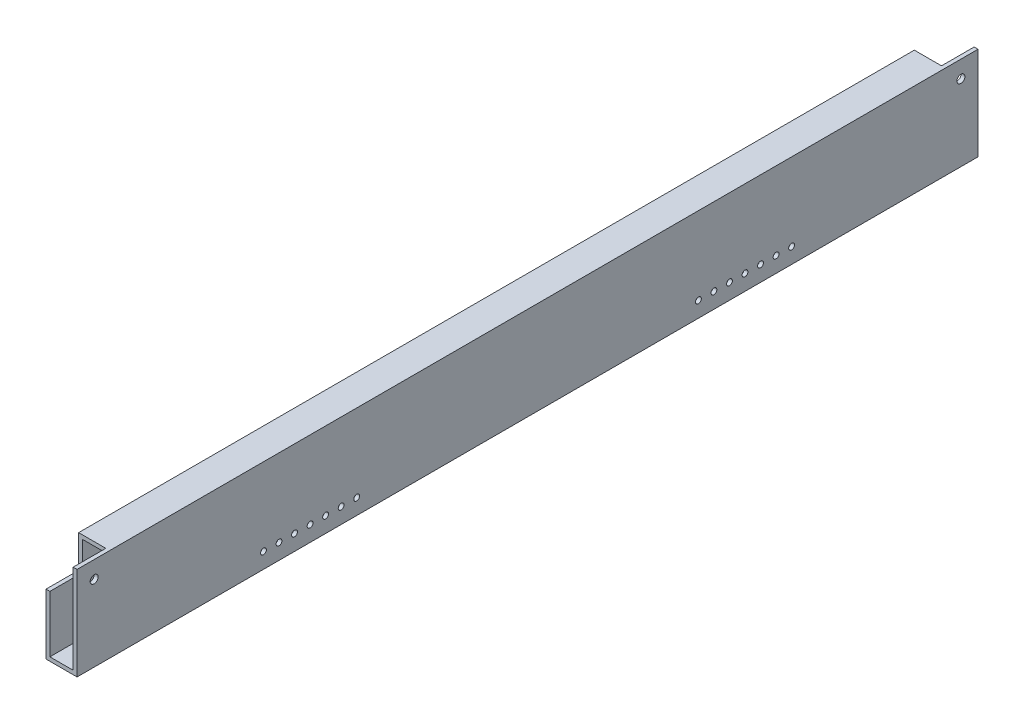
from build123d import *

# Parameters (mm, degrees)
SKETCH1_W           = 25.4
SKETCH1_H           = 76.2
BOSS_EXTRUDE1_DEPTH = 368.3
SHELL1_T            = -3.175
CUT_EXTRUDE2_REACH  = 373.136
SKETCH3_R           = 2.38125
SKETCH4_W           = 26.67
SKETCH4_H           = 26.67
CUT_EXTRUDE3_DEPTH  = 22.225
SKETCH5_R           = 3.25
CUT_EXTRUDE4_DEPTH  = 22.225


with BuildPart() as part:
    # Sketch1 → Boss-Extrude1 (new, symmetric)
    with BuildSketch(Plane.XY):
        Rectangle(SKETCH1_W, SKETCH1_H)
    extrude(amount=BOSS_EXTRUDE1_DEPTH, both=True)

    # Shell1
    shell1_openings = [part.faces().sort_by_distance(p)[0] for p in [
        (0, 0, -368.3),
        (0, 0, 368.3),
    ]]
    offset(amount=SHELL1_T, openings=shell1_openings, kind=Kind.INTERSECTION)

    # Sketch3 → Cut-Extrude2 (cut, up to next)
    with BuildSketch(Plane(origin=(12.7, 0, 0), x_dir=(0, 0, -1), z_dir=(1, 0, 0)), mode=Mode.PRIVATE) as cut_extrude2_sk1:
        with Locations((215.9, -25.4)):
            Circle(SKETCH3_R)
    cut_extrude2_tool1 = extrude(cut_extrude2_sk1.sketch, amount=-CUT_EXTRUDE2_REACH, mode=Mode.PRIVATE) & part.part
    # Sketch3 → Cut-Extrude2 (cut, up to next)
    with BuildSketch(Plane(origin=(12.7, 0, 0), x_dir=(0, 0, -1), z_dir=(1, 0, 0)), mode=Mode.PRIVATE) as cut_extrude2_sk2:
        with Locations((203.2, -25.4)):
            Circle(SKETCH3_R)
    cut_extrude2_tool2 = extrude(cut_extrude2_sk2.sketch, amount=-CUT_EXTRUDE2_REACH, mode=Mode.PRIVATE) & part.part
    # Sketch3 → Cut-Extrude2 (cut, up to next)
    with BuildSketch(Plane(origin=(12.7, 0, 0), x_dir=(0, 0, -1), z_dir=(1, 0, 0)), mode=Mode.PRIVATE) as cut_extrude2_sk3:
        with Locations((190.5, -25.4)):
            Circle(SKETCH3_R)
    cut_extrude2_tool3 = extrude(cut_extrude2_sk3.sketch, amount=-CUT_EXTRUDE2_REACH, mode=Mode.PRIVATE) & part.part
    # Sketch3 → Cut-Extrude2 (cut, up to next)
    with BuildSketch(Plane(origin=(12.7, 0, 0), x_dir=(0, 0, -1), z_dir=(1, 0, 0)), mode=Mode.PRIVATE) as cut_extrude2_sk4:
        with Locations((177.8, -25.4)):
            Circle(SKETCH3_R)
    cut_extrude2_tool4 = extrude(cut_extrude2_sk4.sketch, amount=-CUT_EXTRUDE2_REACH, mode=Mode.PRIVATE) & part.part
    # Sketch3 → Cut-Extrude2 (cut, up to next)
    with BuildSketch(Plane(origin=(12.7, 0, 0), x_dir=(0, 0, -1), z_dir=(1, 0, 0)), mode=Mode.PRIVATE) as cut_extrude2_sk5:
        with Locations((165.1, -25.4)):
            Circle(SKETCH3_R)
    cut_extrude2_tool5 = extrude(cut_extrude2_sk5.sketch, amount=-CUT_EXTRUDE2_REACH, mode=Mode.PRIVATE) & part.part
    # Sketch3 → Cut-Extrude2 (cut, up to next)
    with BuildSketch(Plane(origin=(12.7, 0, 0), x_dir=(0, 0, -1), z_dir=(1, 0, 0)), mode=Mode.PRIVATE) as cut_extrude2_sk6:
        with Locations((152.4, -25.4)):
            Circle(SKETCH3_R)
    cut_extrude2_tool6 = extrude(cut_extrude2_sk6.sketch, amount=-CUT_EXTRUDE2_REACH, mode=Mode.PRIVATE) & part.part
    # Sketch3 → Cut-Extrude2 (cut, up to next)
    with BuildSketch(Plane(origin=(12.7, 0, 0), x_dir=(0, 0, -1), z_dir=(1, 0, 0)), mode=Mode.PRIVATE) as cut_extrude2_sk7:
        with Locations((139.7, -25.4)):
            Circle(SKETCH3_R)
    cut_extrude2_tool7 = extrude(cut_extrude2_sk7.sketch, amount=-CUT_EXTRUDE2_REACH, mode=Mode.PRIVATE) & part.part
    # Sketch3 → Cut-Extrude2 (cut, up to next)
    with BuildSketch(Plane(origin=(12.7, 0, 0), x_dir=(0, 0, -1), z_dir=(1, 0, 0)), mode=Mode.PRIVATE) as cut_extrude2_sk8:
        with Locations((-139.7, -25.4)):
            Circle(SKETCH3_R)
    cut_extrude2_tool8 = extrude(cut_extrude2_sk8.sketch, amount=-CUT_EXTRUDE2_REACH, mode=Mode.PRIVATE) & part.part
    # Sketch3 → Cut-Extrude2 (cut, up to next)
    with BuildSketch(Plane(origin=(12.7, 0, 0), x_dir=(0, 0, -1), z_dir=(1, 0, 0)), mode=Mode.PRIVATE) as cut_extrude2_sk9:
        with Locations((-152.4, -25.4)):
            Circle(SKETCH3_R)
    cut_extrude2_tool9 = extrude(cut_extrude2_sk9.sketch, amount=-CUT_EXTRUDE2_REACH, mode=Mode.PRIVATE) & part.part
    # Sketch3 → Cut-Extrude2 (cut, up to next)
    with BuildSketch(Plane(origin=(12.7, 0, 0), x_dir=(0, 0, -1), z_dir=(1, 0, 0)), mode=Mode.PRIVATE) as cut_extrude2_sk10:
        with Locations((-165.1, -25.4)):
            Circle(SKETCH3_R)
    cut_extrude2_tool10 = extrude(cut_extrude2_sk10.sketch, amount=-CUT_EXTRUDE2_REACH, mode=Mode.PRIVATE) & part.part
    # Sketch3 → Cut-Extrude2 (cut, up to next)
    with BuildSketch(Plane(origin=(12.7, 0, 0), x_dir=(0, 0, -1), z_dir=(1, 0, 0)), mode=Mode.PRIVATE) as cut_extrude2_sk11:
        with Locations((-203.2, -25.4)):
            Circle(SKETCH3_R)
    cut_extrude2_tool11 = extrude(cut_extrude2_sk11.sketch, amount=-CUT_EXTRUDE2_REACH, mode=Mode.PRIVATE) & part.part
    # Sketch3 → Cut-Extrude2 (cut, up to next)
    with BuildSketch(Plane(origin=(12.7, 0, 0), x_dir=(0, 0, -1), z_dir=(1, 0, 0)), mode=Mode.PRIVATE) as cut_extrude2_sk12:
        with Locations((-177.8, -25.4)):
            Circle(SKETCH3_R)
    cut_extrude2_tool12 = extrude(cut_extrude2_sk12.sketch, amount=-CUT_EXTRUDE2_REACH, mode=Mode.PRIVATE) & part.part
    # Sketch3 → Cut-Extrude2 (cut, up to next)
    with BuildSketch(Plane(origin=(12.7, 0, 0), x_dir=(0, 0, -1), z_dir=(1, 0, 0)), mode=Mode.PRIVATE) as cut_extrude2_sk13:
        with Locations((-215.9, -25.4)):
            Circle(SKETCH3_R)
    cut_extrude2_tool13 = extrude(cut_extrude2_sk13.sketch, amount=-CUT_EXTRUDE2_REACH, mode=Mode.PRIVATE) & part.part
    # Sketch3 → Cut-Extrude2 (cut, up to next)
    with BuildSketch(Plane(origin=(12.7, 0, 0), x_dir=(0, 0, -1), z_dir=(1, 0, 0)), mode=Mode.PRIVATE) as cut_extrude2_sk14:
        with Locations((-190.5, -25.4)):
            Circle(SKETCH3_R)
    cut_extrude2_tool14 = extrude(cut_extrude2_sk14.sketch, amount=-CUT_EXTRUDE2_REACH, mode=Mode.PRIVATE) & part.part
    add(cut_extrude2_tool1.solids().sort_by_distance((12.7, -25.4, -215.9))[0], mode=Mode.SUBTRACT)
    add(cut_extrude2_tool2.solids().sort_by_distance((12.7, -25.4, -203.2))[0], mode=Mode.SUBTRACT)
    add(cut_extrude2_tool3.solids().sort_by_distance((12.7, -25.4, -190.5))[0], mode=Mode.SUBTRACT)
    add(cut_extrude2_tool4.solids().sort_by_distance((12.7, -25.4, -177.8))[0], mode=Mode.SUBTRACT)
    add(cut_extrude2_tool5.solids().sort_by_distance((12.7, -25.4, -165.1))[0], mode=Mode.SUBTRACT)
    add(cut_extrude2_tool6.solids().sort_by_distance((12.7, -25.4, -152.4))[0], mode=Mode.SUBTRACT)
    add(cut_extrude2_tool7.solids().sort_by_distance((12.7, -25.4, -139.7))[0], mode=Mode.SUBTRACT)
    add(cut_extrude2_tool8.solids().sort_by_distance((12.7, -25.4, 139.7))[0], mode=Mode.SUBTRACT)
    add(cut_extrude2_tool9.solids().sort_by_distance((12.7, -25.4, 152.4))[0], mode=Mode.SUBTRACT)
    add(cut_extrude2_tool10.solids().sort_by_distance((12.7, -25.4, 165.1))[0], mode=Mode.SUBTRACT)
    add(cut_extrude2_tool11.solids().sort_by_distance((12.7, -25.4, 203.2))[0], mode=Mode.SUBTRACT)
    add(cut_extrude2_tool12.solids().sort_by_distance((12.7, -25.4, 177.8))[0], mode=Mode.SUBTRACT)
    add(cut_extrude2_tool13.solids().sort_by_distance((12.7, -25.4, 215.9))[0], mode=Mode.SUBTRACT)
    add(cut_extrude2_tool14.solids().sort_by_distance((12.7, -25.4, 190.5))[0], mode=Mode.SUBTRACT)

    # Sketch4 → Cut-Extrude3 (cut)
    with BuildSketch(Plane.ZY.offset(12.7)):
        with Locations((-354.965, 24.765)):
            Rectangle(SKETCH4_W, SKETCH4_H)
        with Locations((354.965, 24.765)):
            Rectangle(SKETCH4_W, SKETCH4_H)
    extrude(amount=-CUT_EXTRUDE3_DEPTH, mode=Mode.SUBTRACT)

    # Sketch5 → Cut-Extrude4 (cut)
    with BuildSketch(Plane.ZY.offset(-9.525)):
        with Locations((-354.33, 24.13)):
            Circle(SKETCH5_R)
        with Locations((354.33, 24.13)):
            Circle(SKETCH5_R)
    extrude(amount=-CUT_EXTRUDE4_DEPTH, mode=Mode.SUBTRACT)


solid = part.part
